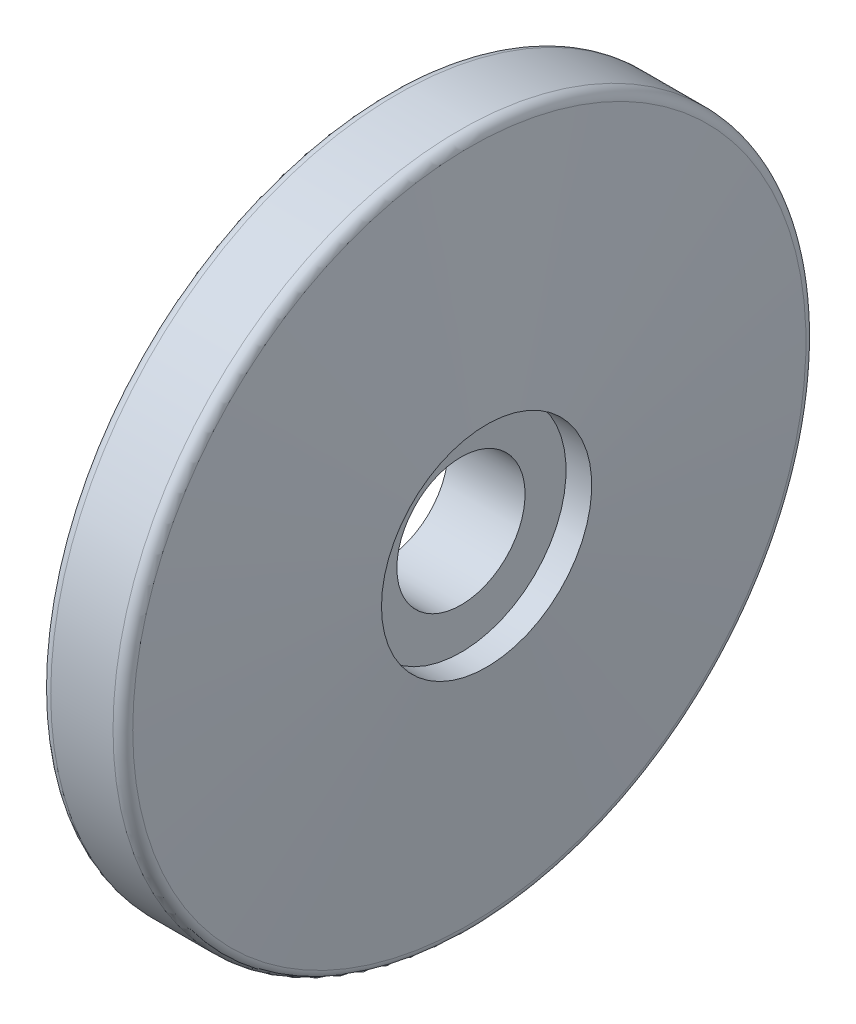
from build123d import *


with BuildPart() as part:
    # Эскиз1 → Повернуть1 (revolve)
    with BuildSketch(Plane.XY):
        with BuildLine():
            Line((6.428300829, 12.5), (-8.571699171, 12.5))
            Line((-8.571699171, 12.5), (-8.571699171, 26))
            Line((-8.571699171, 26), (-13.071699171, 26))
            Line((-13.071699171, 26), (-13.071699171, 30))
            Line((-13.071699171, 30), (-8.071699171, 30))
            Line((-8.071699171, 30), (-8.071699171, 65.5))
            ThreePointArc((-8.071699171, 65.5), (-7.485912733, 66.914213562), (-6.071699171, 67.5))
            Line((-6.071699171, 67.5), (6.071699171, 67.5))
            ThreePointArc((6.071699171, 67.5), (7.432388365, 66.965784745), (8.066176633, 65.648524917))
            Line((8.066176633, 65.648524917), (11.428300829, 20.5))
            Line((11.428300829, 20.5), (6.428300829, 20.5))
            Line((6.428300829, 20.5), (6.428300829, 12.5))
        make_face()
    revolve(axis=Axis((-643.332684128, 0, 0), (1, 0, 0)))


solid = part.part
